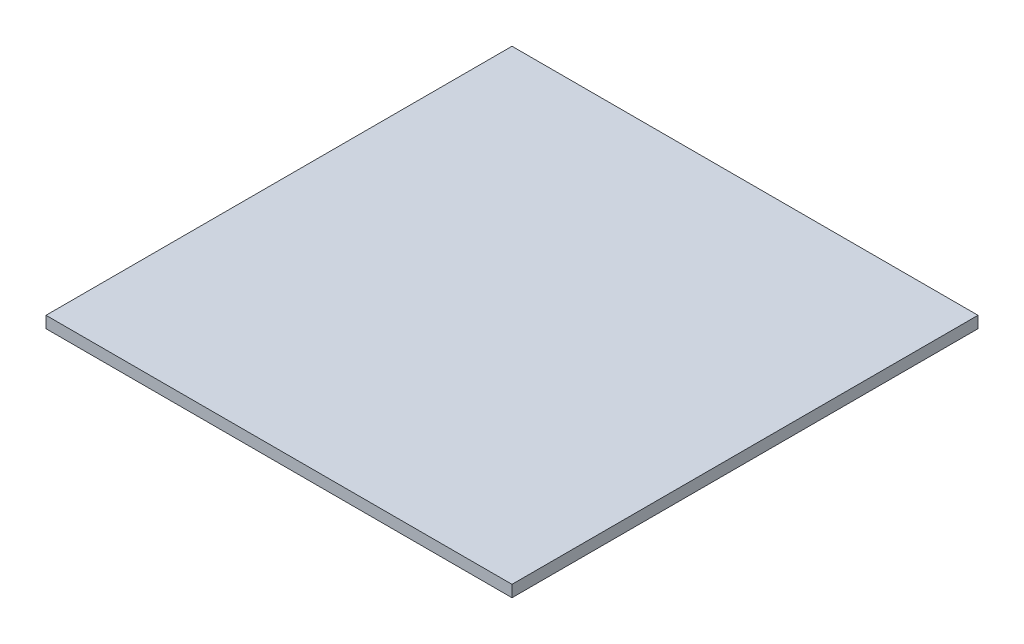
from build123d import *

# Parameters (mm, degrees)
SKETCH1_W           = 254
SKETCH1_H           = 254
BOSS_EXTRUDE1_DEPTH = 6.35


with BuildPart() as part:
    # Sketch1 → Boss-Extrude1 (new body)
    with BuildSketch(Plane(origin=(0, 0, 0), x_dir=(1, 0, 0), z_dir=(0, 1, 0))):
        with Locations((127, 127)):
            Rectangle(SKETCH1_W, SKETCH1_H)
    extrude(amount=BOSS_EXTRUDE1_DEPTH)


solid = part.part
